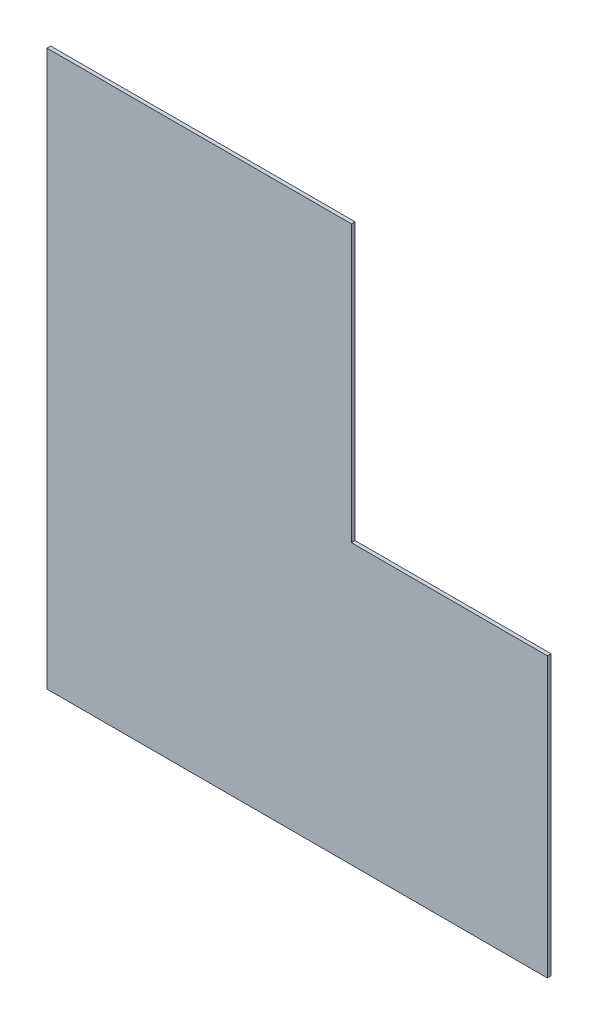
from build123d import *

# Parameters (mm, degrees)
TABAN_FLAN_1_DEPTH          = 15
KES_EKSTR_ZYON1_DEPTH       = 6824.599709831
KES_EKSTR_ZYON1_DEPTH_BACK  = 6824.599709831
IZIM2_W                     = 2518
IZIM2_H                     = 130
KES_EKSTR_ZYON2_DEPTH       = 6824.599709831
KES_EKSTR_ZYON2_DEPTH_BACK  = 6824.599709831
IZIM3_W                     = 2518
IZIM3_H                     = 135
KES_EKSTR_ZYON3_DEPTH       = 6824.599709831
KES_EKSTR_ZYON3_DEPTH_BACK  = 6824.599709831
IZIM4_W                     = 848
IZIM4_H                     = 915
KES_EKSTR_ZYON4_DEPTH       = 5983.714935546
KES_EKSTR_ZYON4_DEPTH_BACK  = 5983.714935546
IZIM5_W                     = 848
IZIM5_H                     = 467
KES_EKSTR_ZYON5_DEPTH       = 5563.566763644
KES_EKSTR_ZYON5_DEPTH_BACK  = 5563.566763644
IZIM6_W                     = 2518
IZIM6_H                     = 805
IZIM6_W_2                   = 848
IZIM6_H_2                   = 3
KES_EKSTR_ZYON6_DEPTH       = 5560.891905424
KES_EKSTR_ZYON6_DEPTH_BACK  = 5560.891905424
IZIM7_W                     = 2518
IZIM7_H                     = 440
KES_EKSTR_ZYON7_DEPTH       = 5560.891905424
KES_EKSTR_ZYON7_DEPTH_BACK  = 5560.891905424
IZIM8_W                     = 2518
IZIM8_H                     = 102
KES_EKSTR_ZYON8_DEPTH       = 5560.891905424
KES_EKSTR_ZYON8_DEPTH_BACK  = 5560.891905424
IZIM9_W                     = 2518
IZIM9_H                     = 158
IZIM10_W                    = 542
IZIM10_H                    = 327
SEKME1_DEPTH                = 15
KES_EKSTR_ZYON9_DEPTH       = 5560.891905424
KES_EKSTR_ZYON9_DEPTH_BACK  = 5560.891905424
IZIM11_W                    = 1127
IZIM11_H                    = 305
IZIM12_W                    = 1390
IZIM12_H                    = 43
SEKME2_DEPTH                = 15
KES_EKSTR_ZYON10_DEPTH      = 5599.263034192
KES_EKSTR_ZYON10_DEPTH_BACK = 5599.263034192
IZIM13_W                    = 2518
IZIM13_H                    = 127
KES_EKSTR_ZYON11_DEPTH      = 5599.263034192
KES_EKSTR_ZYON11_DEPTH_BACK = 5599.263034192
IZIM14_W                    = 385
IZIM14_H                    = 675
IZIM14_W_2                  = 2518
IZIM14_H_2                  = 148
KES_EKSTR_ZYON12_DEPTH      = 5599.263034192
KES_EKSTR_ZYON12_DEPTH_BACK = 5599.263034192
IZIM15_W                    = 569.702453624
IZIM15_H                    = 675
KES_EKSTR_ZYON13_DEPTH      = 5599.263034192
KES_EKSTR_ZYON13_DEPTH_BACK = 5599.263034192
IZIM16_W                    = 1005
IZIM16_H                    = 305
KES_EKSTR_ZYON14_DEPTH      = 5328.623672896
KES_EKSTR_ZYON14_DEPTH_BACK = 5328.623672896
IZIM17_W                    = 200
IZIM17_H                    = 370
IZIM17_W_2                  = 3
IZIM17_H_2                  = 2280
KES_EKSTR_ZYON16_DEPTH      = 5005.615269928
KES_EKSTR_ZYON16_DEPTH_BACK = 5005.615269928
KES_EKSTR_ZYON17_DEPTH      = 5005.615269928
KES_EKSTR_ZYON17_DEPTH_BACK = 5005.615269928
IZIM20_W                    = 805
IZIM20_H                    = 164


# Sheet-metal steps are written as plain solids
with BuildPart() as part:
    # Çizim1 → Taban-Flanş1 (new body)
    with BuildSketch(Plane.XY):
        Polygon((0, 0), (0, 4630), (1505, 4630), (1505, 6342), (2518, 6342), (2518, 0), align=None)
    extrude(amount=-TABAN_FLAN_1_DEPTH)

    # Çizim2 → Kes-Ekstrüzyon1 (cut, two sides: drawn at the far end of the back side and taken through both)
    with BuildSketch(Plane.XY.offset(-KES_EKSTR_ZYON1_DEPTH_BACK)):
        with Locations((1259, 65)):
            Rectangle(IZIM2_W, IZIM2_H)
    extrude(amount=KES_EKSTR_ZYON1_DEPTH + KES_EKSTR_ZYON1_DEPTH_BACK, mode=Mode.SUBTRACT)

    # Çizim3 → Kes-Ekstrüzyon2 (cut, two sides: drawn at the far end of the back side and taken through both)
    with BuildSketch(Plane.XY.offset(-KES_EKSTR_ZYON2_DEPTH_BACK)):
        with Locations((1259, 197.5)):
            Rectangle(IZIM3_W, IZIM3_H)
    extrude(amount=KES_EKSTR_ZYON2_DEPTH + KES_EKSTR_ZYON2_DEPTH_BACK, mode=Mode.SUBTRACT)

    # Çizim4 → Kes-Ekstrüzyon3 (cut, two sides: drawn at the far end of the back side and taken through both)
    with BuildSketch(Plane.XY.offset(-KES_EKSTR_ZYON3_DEPTH_BACK)):
        with Locations((2094, 5884.5)):
            Rectangle(IZIM4_W, IZIM4_H)
        Polygon((1670, 6342), (1505, 6342), (1505, 4630), (1670, 4630), (1670, 5427), align=None)
    extrude(amount=KES_EKSTR_ZYON3_DEPTH + KES_EKSTR_ZYON3_DEPTH_BACK, mode=Mode.SUBTRACT)

    # Çizim5 → Kes-Ekstrüzyon4 (cut, two sides: drawn at the far end of the back side and taken through both)
    with BuildSketch(Plane.XY.offset(-KES_EKSTR_ZYON4_DEPTH_BACK)):
        with Locations((2094, 5193.5)):
            Rectangle(IZIM5_W, IZIM5_H)
    extrude(amount=KES_EKSTR_ZYON4_DEPTH + KES_EKSTR_ZYON4_DEPTH_BACK, mode=Mode.SUBTRACT)

    # Çizim6 → Kes-Ekstrüzyon5 (cut, two sides: drawn at the far end of the back side and taken through both)
    with BuildSketch(Plane.XY.offset(-KES_EKSTR_ZYON5_DEPTH_BACK)):
        with Locations((1259, 667.5)):
            Rectangle(IZIM6_W, IZIM6_H)
        with Locations((2094, 4958.5)):
            Rectangle(IZIM6_W_2, IZIM6_H_2)
    extrude(amount=KES_EKSTR_ZYON5_DEPTH + KES_EKSTR_ZYON5_DEPTH_BACK, mode=Mode.SUBTRACT)

    # Çizim7 → Kes-Ekstrüzyon6 (cut, two sides: drawn at the far end of the back side and taken through both)
    with BuildSketch(Plane.XY.offset(-KES_EKSTR_ZYON6_DEPTH_BACK)):
        with Locations((1259, 1290)):
            Rectangle(IZIM7_W, IZIM7_H)
    extrude(amount=KES_EKSTR_ZYON6_DEPTH + KES_EKSTR_ZYON6_DEPTH_BACK, mode=Mode.SUBTRACT)

    # Çizim8 → Kes-Ekstrüzyon7 (cut, two sides: drawn at the far end of the back side and taken through both)
    with BuildSketch(Plane.XY.offset(-KES_EKSTR_ZYON7_DEPTH_BACK)):
        with Locations((1259, 1561)):
            Rectangle(IZIM8_W, IZIM8_H)
    extrude(amount=KES_EKSTR_ZYON7_DEPTH + KES_EKSTR_ZYON7_DEPTH_BACK, mode=Mode.SUBTRACT)

    # Çizim9 → Kes-Ekstrüzyon8 (cut, two sides: drawn at the far end of the back side and taken through both)
    with BuildSketch(Plane.XY.offset(-KES_EKSTR_ZYON8_DEPTH_BACK)):
        with Locations((1259, 1691)):
            Rectangle(IZIM9_W, IZIM9_H)
    extrude(amount=KES_EKSTR_ZYON8_DEPTH + KES_EKSTR_ZYON8_DEPTH_BACK, mode=Mode.SUBTRACT)

    # Çizim10 → Sekme1 (add)
    with BuildSketch(Plane.XY):
        with Locations((1399, 4793.5)):
            Rectangle(IZIM10_W, IZIM10_H)
    extrude(amount=-SEKME1_DEPTH)

    # Çizim11 → Kes-Ekstrüzyon9 (cut, two sides: drawn at the far end of the back side and taken through both)
    with BuildSketch(Plane.XY.offset(-KES_EKSTR_ZYON9_DEPTH_BACK)):
        with Locations((563.5, 4477.5)):
            Rectangle(IZIM11_W, IZIM11_H)
    extrude(amount=KES_EKSTR_ZYON9_DEPTH + KES_EKSTR_ZYON9_DEPTH_BACK, mode=Mode.SUBTRACT)

    # Çizim12 → Sekme2 (add)
    with BuildSketch(Plane.XY):
        with Locations((1823, 4978.5)):
            Rectangle(IZIM12_W, IZIM12_H)
    extrude(amount=-SEKME2_DEPTH)

    # Çizim13 → Kes-Ekstrüzyon10 (cut, two sides: drawn at the far end of the back side and taken through both)
    with BuildSketch(Plane(origin=(0, 0, -15), x_dir=(-1, 0, 0), z_dir=(0, 0, -1)).offset(-KES_EKSTR_ZYON10_DEPTH_BACK)):
        with Locations((-1259, 1833.5)):
            Rectangle(IZIM13_W, IZIM13_H)
    extrude(amount=KES_EKSTR_ZYON10_DEPTH + KES_EKSTR_ZYON10_DEPTH_BACK, mode=Mode.SUBTRACT)

    # Çizim14 → Kes-Ekstrüzyon11 (cut, two sides: drawn at the far end of the back side and taken through both)
    with BuildSketch(Plane.XY.offset(-KES_EKSTR_ZYON11_DEPTH_BACK)):
        with Locations((1320.5, 4662.5)):
            Rectangle(IZIM14_W, IZIM14_H)
        with Locations((1259, 1971)):
            Rectangle(IZIM14_W_2, IZIM14_H_2)
    extrude(amount=KES_EKSTR_ZYON11_DEPTH + KES_EKSTR_ZYON11_DEPTH_BACK, mode=Mode.SUBTRACT)

    # Çizim15 → Kes-Ekstrüzyon12 (cut, two sides: drawn at the far end of the back side and taken through both)
    with BuildSketch(Plane.XY.offset(-KES_EKSTR_ZYON12_DEPTH_BACK)):
        with Locations((1228.148773188, 4662.5)):
            Rectangle(IZIM15_W, IZIM15_H)
    extrude(amount=KES_EKSTR_ZYON12_DEPTH + KES_EKSTR_ZYON12_DEPTH_BACK, mode=Mode.SUBTRACT)

    # Çizim16 → Kes-Ekstrüzyon13 (cut, two sides: drawn at the far end of the back side and taken through both)
    with BuildSketch(Plane.XY.offset(-KES_EKSTR_ZYON13_DEPTH_BACK)):
        with Locations((2015.5, 4847.5)):
            Rectangle(IZIM16_W, IZIM16_H)
    extrude(amount=KES_EKSTR_ZYON13_DEPTH + KES_EKSTR_ZYON13_DEPTH_BACK, mode=Mode.SUBTRACT)

    # Çizim17 → Kes-Ekstrüzyon14 (cut, two sides: drawn at the far end of the back side and taken through both)
    with BuildSketch(Plane.XY.offset(-KES_EKSTR_ZYON14_DEPTH_BACK)):
        Polygon((2518, 3355), (2518, 4695), (1713, 4695), (1713, 4325), (1713, 3355), align=None)
        with Locations((1613, 4510)):
            Rectangle(IZIM17_W, IZIM17_H)
        with Locations((1.5, 3185)):
            Rectangle(IZIM17_W_2, IZIM17_H_2)
    extrude(amount=KES_EKSTR_ZYON14_DEPTH + KES_EKSTR_ZYON14_DEPTH_BACK, mode=Mode.SUBTRACT)

    # Çizim19 → Kes-Ekstrüzyon16 (cut, two sides: drawn at the far end of the back side and taken through both)
    with BuildSketch(Plane.XY.offset(-KES_EKSTR_ZYON16_DEPTH_BACK)):
        Polygon((463, 4325), (463, 2045), (3, 2045), (0, 4325), align=None)
    extrude(amount=KES_EKSTR_ZYON16_DEPTH + KES_EKSTR_ZYON16_DEPTH_BACK, mode=Mode.SUBTRACT)

    # Çizim20 → Kes-Ekstrüzyon17 (cut, two sides: drawn at the far end of the back side and taken through both)
    with BuildSketch(Plane.XY.offset(-KES_EKSTR_ZYON17_DEPTH_BACK)):
        with Locations((2115.5, 3273)):
            Rectangle(IZIM20_W, IZIM20_H)
    extrude(amount=KES_EKSTR_ZYON17_DEPTH + KES_EKSTR_ZYON17_DEPTH_BACK, mode=Mode.SUBTRACT)


solid = part.part
